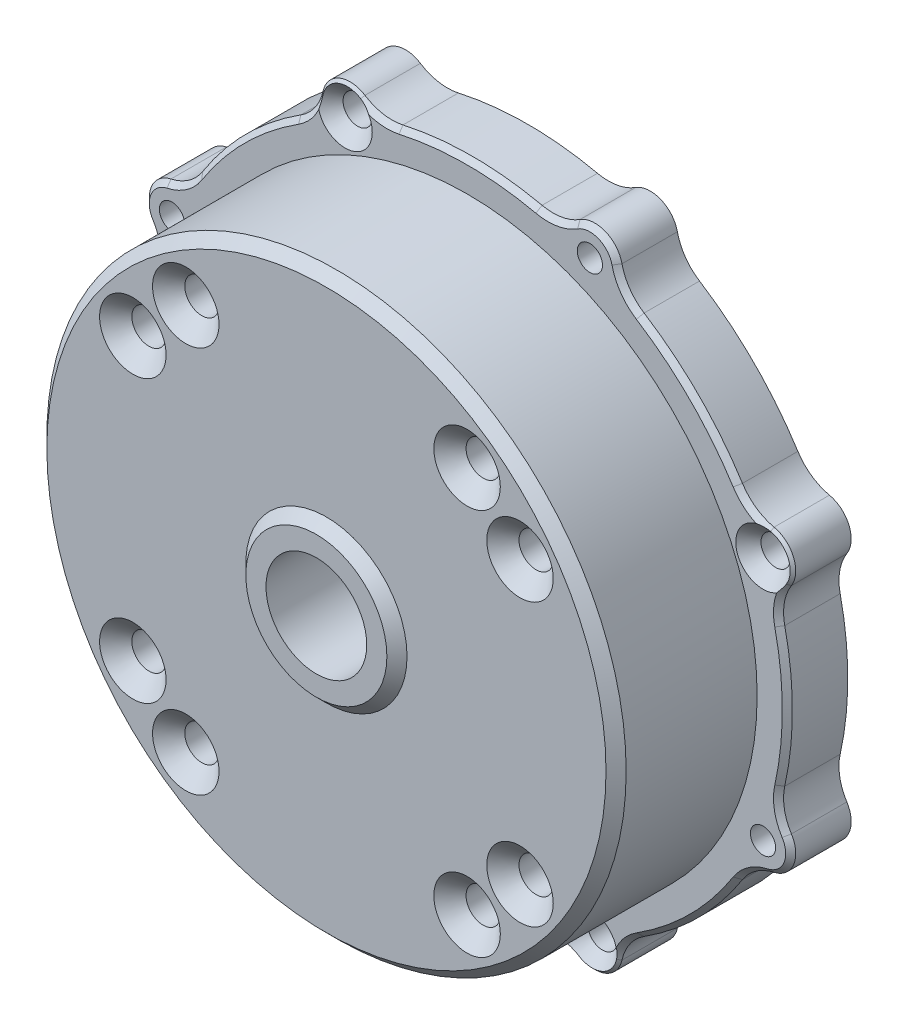
from build123d import *

# Parameters (mm, degrees)
SKETCH_1_R                = 28.75
SKETCH_1_R_2              = 5
SKETCH_1_R_3              = 1.5
EXTRUDE_1_DEPTH           = 3
EXTRUDE_START             = 17
SKETCH_2_R                = 28.75
SKETCH_2_R_2              = 27
EXTRUDE_2_DEPTH           = 17
SKETCH_3_R                = 27
SKETCH_3_R_2              = 1.25
EXTRUDE_3_DEPTH           = 6
CHAMFER_1_SIZE            = 1
CHAMFER_2_SIZE            = 0.5
HOLE_WIZARD_0_D           = 3.4
HOLE_WIZARD_0_DEPTH       = 6.35
HOLE_WIZARD_0_CSINK_D     = 6.6
HOLE_WIZARD_0_CSINK_ANGLE = 90
HOLE_WIZARD_0_TIP         = 1.021463052
EXTRUDE_START_2           = 5
SKETCH_7_R                = 27
SKETCH_7_R_2              = 5
SKETCH_7_R_3              = 1.7
EXTRUDE_4_DEPTH           = 5
SKETCH_8_R                = 7
SKETCH_8_R_2              = 5
EXTRUDE_5_DEPTH           = 1
CHAMFER_3_SIZE            = 1
CUT_EXTRUDE_1_DEPTH       = 11
CUT_EXTRUDE_1_DEPTH_BACK  = 9.5
FILLET_1_R                = 0.5
HOLE_START                = -18
HOLE_WIZARD_1_OUTLINE_R   = 1.45
HOLE_WIZARD_1_OUTLINE_R_2 = 1.25
HOLE_WIZARD_1_DEPTH       = 7


with BuildPart() as part:
    # 草图1 → 凸台-拉伸1 (new body)
    with BuildSketch(Plane.XY):
        Circle(SKETCH_1_R)
        Circle(SKETCH_1_R_2, mode=Mode.SUBTRACT)
        with Locations((13.959899742, 19.214153616)):
            Circle(SKETCH_1_R_3, mode=Mode.SUBTRACT)
        with Locations((19.214153616, 13.959899742)):
            Circle(SKETCH_1_R_3, mode=Mode.SUBTRACT)
        with Locations((19.214153616, -13.959899742)):
            Circle(SKETCH_1_R_3, mode=Mode.SUBTRACT)
        with Locations((13.959899742, -19.214153616)):
            Circle(SKETCH_1_R_3, mode=Mode.SUBTRACT)
        with Locations((-13.959899742, -19.214153616)):
            Circle(SKETCH_1_R_3, mode=Mode.SUBTRACT)
        with Locations((-19.214153616, -13.959899742)):
            Circle(SKETCH_1_R_3, mode=Mode.SUBTRACT)
        with Locations((-19.214153616, 13.959899742)):
            Circle(SKETCH_1_R_3, mode=Mode.SUBTRACT)
        with Locations((-13.959899742, 19.214153616)):
            Circle(SKETCH_1_R_3, mode=Mode.SUBTRACT)
    extrude(amount=EXTRUDE_1_DEPTH)

    # 草图2 → 凸台-拉伸2 (add)
    with BuildSketch(Plane(origin=(0, 0, 0), x_dir=(-1, 0, 0), z_dir=(0, 0, -1)).offset(EXTRUDE_START)):
        with Locations(Location((0, 0, 0), (0, 0, 90))):
            Circle(SKETCH_2_R)
        with Locations(Location((0, 0, 0), (0, 0, 90))):
            Circle(SKETCH_2_R_2, mode=Mode.SUBTRACT)
    extrude(amount=-EXTRUDE_2_DEPTH)

    # 草图3 → 凸台-拉伸3 (add)
    with BuildSketch(Plane(origin=(0, 0, -17), x_dir=(-1, 0, 0), z_dir=(0, 0, -1))):
        with BuildLine():
            ThreePointArc((-30.990743265, 6.901907846), (-30.946539181, 8.853668896), (-31.653110683, 10.673581506))
            ThreePointArc((-31.653110683, 10.673581506), (-31.873843872, 13.202578417), (-29.929491072, 14.834767347))
            ThreePointArc((-29.929491072, 14.834767347), (-28.142997024, 15.622018395), (-26.794150557, 17.033378876))
            ThreePointArc((-26.794150557, 17.033378876), (-22.450640303, 22.450640303), (-17.033378876, 26.794150557))
            ThreePointArc((-17.033378876, 26.794150557), (-15.622018395, 28.142997024), (-14.834767347, 29.929491072))
            ThreePointArc((-14.834767347, 29.929491072), (-13.202578417, 31.873843872), (-10.673581506, 31.653110683))
            ThreePointArc((-10.673581506, 31.653110683), (-8.853668896, 30.946539181), (-6.901907846, 30.990743265))
            ThreePointArc((-6.901907846, 30.990743265), (0, 31.75), (6.901907846, 30.990743265))
            ThreePointArc((6.901907846, 30.990743265), (8.853668896, 30.946539181), (10.673581506, 31.653110683))
            ThreePointArc((10.673581506, 31.653110683), (13.202578417, 31.873843872), (14.834767347, 29.929491072))
            ThreePointArc((14.834767347, 29.929491072), (15.622018395, 28.142997024), (17.033378876, 26.794150557))
            ThreePointArc((17.033378876, 26.794150557), (22.450640303, 22.450640303), (26.794150557, 17.033378876))
            ThreePointArc((26.794150557, 17.033378876), (28.142997024, 15.622018395), (29.929491072, 14.834767347))
            ThreePointArc((29.929491072, 14.834767347), (31.873843872, 13.202578417), (31.653110683, 10.673581506))
            ThreePointArc((31.653110683, 10.673581506), (30.946539181, 8.853668896), (30.990743265, 6.901907846))
            ThreePointArc((30.990743265, 6.901907846), (31.75, 0), (30.990743265, -6.901907846))
            ThreePointArc((30.990743265, -6.901907846), (30.946539181, -8.853668896), (31.653110683, -10.673581506))
            ThreePointArc((31.653110683, -10.673581506), (31.873843872, -13.202578417), (29.929491072, -14.834767347))
            ThreePointArc((29.929491072, -14.834767347), (28.142997024, -15.622018395), (26.794150557, -17.033378876))
            ThreePointArc((26.794150557, -17.033378876), (22.450640303, -22.450640303), (17.033378876, -26.794150557))
            ThreePointArc((17.033378876, -26.794150557), (15.622018395, -28.142997024), (14.834767347, -29.929491072))
            ThreePointArc((14.834767347, -29.929491072), (13.202578417, -31.873843872), (10.673581506, -31.653110683))
            ThreePointArc((10.673581506, -31.653110683), (8.853668896, -30.946539181), (6.901907846, -30.990743265))
            ThreePointArc((6.901907846, -30.990743265), (0, -31.75), (-6.901907846, -30.990743265))
            ThreePointArc((-6.901907846, -30.990743265), (-8.853668896, -30.946539181), (-10.673581506, -31.653110683))
            ThreePointArc((-10.673581506, -31.653110683), (-13.202578417, -31.873843872), (-14.834767347, -29.929491072))
            ThreePointArc((-14.834767347, -29.929491072), (-15.622018395, -28.142997024), (-17.033378876, -26.794150557))
            ThreePointArc((-17.033378876, -26.794150557), (-22.450640303, -22.450640303), (-26.794150557, -17.033378876))
            ThreePointArc((-26.794150557, -17.033378876), (-28.142997024, -15.622018395), (-29.929491072, -14.834767347))
            ThreePointArc((-29.929491072, -14.834767347), (-31.873843872, -13.202578417), (-31.653110683, -10.673581506))
            ThreePointArc((-31.653110683, -10.673581506), (-30.946539181, -8.853668896), (-30.990743265, -6.901907846))
            ThreePointArc((-30.990743265, -6.901907846), (-31.75, 0), (-30.990743265, 6.901907846))
        make_face()
        with Locations(Location((0, 0, 0), (0, 0, 90))):
            Circle(SKETCH_3_R, mode=Mode.SUBTRACT)
        with Locations(Location((-29.333175157, 12.150198978, 0), (0, 0, 90))):
            Circle(SKETCH_3_R_2, mode=Mode.SUBTRACT)
        with Locations(Location((-12.150198978, 29.333175157, 0), (0, 0, 90))):
            Circle(SKETCH_3_R_2, mode=Mode.SUBTRACT)
        with Locations(Location((12.150198978, 29.333175157, 0), (0, 0, 90))):
            Circle(SKETCH_3_R_2, mode=Mode.SUBTRACT)
        with Locations(Location((29.333175157, 12.150198978, 0), (0, 0, 90))):
            Circle(SKETCH_3_R_2, mode=Mode.SUBTRACT)
        with Locations(Location((29.333175157, -12.150198978, 0), (0, 0, 90))):
            Circle(SKETCH_3_R_2, mode=Mode.SUBTRACT)
        with Locations(Location((12.150198978, -29.333175157, 0), (0, 0, 90))):
            Circle(SKETCH_3_R_2, mode=Mode.SUBTRACT)
        with Locations(Location((-12.150198978, -29.333175157, 0), (0, 0, 90))):
            Circle(SKETCH_3_R_2, mode=Mode.SUBTRACT)
        with Locations(Location((-29.333175157, -12.150198978, 0), (0, 0, 90))):
            Circle(SKETCH_3_R_2, mode=Mode.SUBTRACT)
    extrude(amount=-EXTRUDE_3_DEPTH)

    # 倒角1
    chamfer_1_edges = [part.edges().sort_by_distance(p)[0] for p in [
        (-28.75, 0, 3),
    ]]
    chamfer(chamfer_1_edges, length=CHAMFER_1_SIZE)

    # 倒角2
    chamfer_2_edges = [part.edges().sort_by_distance(p)[0] for p in [
        (31.75, 0, -11),
        (30.946539181, 8.853668896, -11),
        (31.873843872, 13.202578417, -11),
        (28.142997024, 15.622018395, -11),
        (22.450640303, 22.450640303, -11),
        (15.622018395, 28.142997024, -11),
        (13.202578417, 31.873843872, -11),
        (8.853668896, 30.946539181, -11),
        (0, 31.75, -11),
        (-8.853668896, 30.946539181, -11),
        (-13.202578417, 31.873843872, -11),
        (-15.622018395, 28.142997024, -11),
        (-22.450640303, 22.450640303, -11),
        (-28.142997024, 15.622018395, -11),
        (-31.873843872, 13.202578417, -11),
        (-30.946539181, 8.853668896, -11),
        (-31.75, 0, -11),
        (-30.946539181, -8.853668896, -11),
        (-31.873843872, -13.202578417, -11),
        (-28.142997024, -15.622018395, -11),
        (-22.450640303, -22.450640303, -11),
        (-15.622018395, -28.142997024, -11),
        (-13.202578417, -31.873843872, -11),
        (-8.853668896, -30.946539181, -11),
        (0, -31.75, -11),
        (8.853668896, -30.946539181, -11),
        (13.202578417, -31.873843872, -11),
        (15.622018395, -28.142997024, -11),
        (22.450640303, -22.450640303, -11),
        (28.142997024, -15.622018395, -11),
        (31.873843872, -13.202578417, -11),
        (30.946539181, -8.853668896, -11),
    ]]
    chamfer(chamfer_2_edges, length=CHAMFER_2_SIZE)

    # 打孔尺寸(%根据十字)槽沉头木螺钉的类型0
    with Locations(Plane.XY.offset(3)):
        with Locations((19.214153616, 13.959899742), (13.959899742, 19.214153616), (-13.959899742, 19.214153616), (-19.214153616, 13.959899742), (-19.214153616, -13.959899742), (-13.959899742, -19.214153616), (13.959899742, -19.214153616), (19.214153616, -13.959899742)):
            CounterSinkHole(HOLE_WIZARD_0_D / 2, HOLE_WIZARD_0_CSINK_D / 2, depth=HOLE_WIZARD_0_DEPTH, counter_sink_angle=HOLE_WIZARD_0_CSINK_ANGLE)
            with Locations((0, 0, -(HOLE_WIZARD_0_DEPTH + HOLE_WIZARD_0_TIP / 2))):  # 118° drill point
                Cone(0, HOLE_WIZARD_0_D / 2, HOLE_WIZARD_0_TIP, mode=Mode.SUBTRACT)

    # 草图7 → 凸台-拉伸4 (add)
    with BuildSketch(Plane(origin=(0, 0, 0), x_dir=(-1, 0, 0), z_dir=(0, 0, -1)).offset(EXTRUDE_START_2)):
        with Locations(Location((0, 0, 0), (0, 0, 90))):
            Circle(SKETCH_7_R)
        Circle(SKETCH_7_R_2, mode=Mode.SUBTRACT)
        with Locations(Location((19.214153616, -13.959899742, 0), (0, 0, 180))):
            Circle(SKETCH_7_R_3, mode=Mode.SUBTRACT)
        with Locations(Location((13.959899742, -19.214153616, 0), (0, 0, 180))):
            Circle(SKETCH_7_R_3, mode=Mode.SUBTRACT)
        with Locations(Location((-13.959899742, -19.214153616, 0), (0, 0, 180))):
            Circle(SKETCH_7_R_3, mode=Mode.SUBTRACT)
        with Locations(Location((-19.214153616, -13.959899742, 0), (0, 0, 180))):
            Circle(SKETCH_7_R_3, mode=Mode.SUBTRACT)
        with Locations(Location((-19.214153616, 13.959899742, 0), (0, 0, 180))):
            Circle(SKETCH_7_R_3, mode=Mode.SUBTRACT)
        with Locations(Location((-13.959899742, 19.214153616, 0), (0, 0, 180))):
            Circle(SKETCH_7_R_3, mode=Mode.SUBTRACT)
        with Locations(Location((19.214153616, 13.959899742, 0), (0, 0, 180))):
            Circle(SKETCH_7_R_3, mode=Mode.SUBTRACT)
        with Locations(Location((13.959899742, 19.214153616, 0), (0, 0, 180))):
            Circle(SKETCH_7_R_3, mode=Mode.SUBTRACT)
    extrude(amount=-EXTRUDE_4_DEPTH)

    # 草图8 → 凸台-拉伸5 (add)
    with BuildSketch(Plane.XY.offset(3)):
        Circle(SKETCH_8_R)
        with Locations(Location((0, 0, 0), (0, 0, 180))):
            Circle(SKETCH_8_R_2, mode=Mode.SUBTRACT)
    extrude(amount=EXTRUDE_5_DEPTH)

    # 倒角3
    chamfer_3_edges = [part.edges().sort_by_distance(p)[0] for p in [
        (-7, 0, 3),
    ]]
    chamfer(chamfer_3_edges, length=CHAMFER_3_SIZE - 0.0001)  # a hair under: the kernel refuses the full size

    # 草图9 → 切除-拉伸1 (cut, two sides: drawn at the far end of the back side and taken through both)
    with BuildSketch(Plane.ZY.offset(29.5).offset(-CUT_EXTRUDE_1_DEPTH_BACK)):
        with BuildLine():
            Line((-9.9, 7.85), (-17, 7.85))
            Line((-17, 7.85), (-17, -7.85))
            Line((-17, -7.85), (-9.9, -7.85))
            ThreePointArc((-9.9, -7.85), (-9.546446609, -7.703553391), (-9.4, -7.35))
            Line((-9.4, -7.35), (-9.4, 7.35))
            ThreePointArc((-9.4, 7.35), (-9.546446609, 7.703553391), (-9.9, 7.85))
        make_face()
    extrude(amount=CUT_EXTRUDE_1_DEPTH + CUT_EXTRUDE_1_DEPTH_BACK, mode=Mode.SUBTRACT)

    # 圆角1
    fillet_1_edges = [part.edges().sort_by_distance(p)[0] for p in [
        (-30.873102814, -7.85, -14.25),
        (-30.873102814, 7.85, -14.25),
    ]]
    fillet(fillet_1_edges, radius=FILLET_1_R)

    # 打孔尺寸(%根据十字)槽沉头木螺钉的类型1: read off the stored shape, not the designer's step
    # 打孔尺寸(%根据十字)槽沉头木螺钉的类型1 outline → 打孔尺寸(%根据十字)槽沉头木螺钉的类型1 (cut)
    # profile 1 of 4: a face of its own
    with BuildSketch(Plane.XY.offset(HOLE_START)):
        with Locations((-12.150198978, 29.333175157)):
            Circle(HOLE_WIZARD_1_OUTLINE_R)
        with Locations((-12.150198978, 29.333175157)):
            Circle(HOLE_WIZARD_1_OUTLINE_R_2, mode=Mode.SUBTRACT)
    # profile 2 of 4: a face of its own
    with BuildSketch(Plane.XY.offset(HOLE_START)):
        with Locations((29.333175157, 12.150198978)):
            Circle(HOLE_WIZARD_1_OUTLINE_R)
        with Locations((29.333175157, 12.150198978)):
            Circle(HOLE_WIZARD_1_OUTLINE_R_2, mode=Mode.SUBTRACT)
    # profile 3 of 4: a face of its own
    with BuildSketch(Plane.XY.offset(HOLE_START)):
        with Locations((12.150198978, -29.333175157)):
            Circle(HOLE_WIZARD_1_OUTLINE_R)
        with Locations((12.150198978, -29.333175157)):
            Circle(HOLE_WIZARD_1_OUTLINE_R_2, mode=Mode.SUBTRACT)
    # profile 4 of 4: a face of its own
    with BuildSketch(Plane.XY.offset(HOLE_START)):
        with Locations((-29.333175157, -12.150198978)):
            Circle(HOLE_WIZARD_1_OUTLINE_R)
        with Locations((-29.333175157, -12.150198978)):
            Circle(HOLE_WIZARD_1_OUTLINE_R_2, mode=Mode.SUBTRACT)
    extrude(amount=HOLE_WIZARD_1_DEPTH, mode=Mode.SUBTRACT)

    # Hole Wizard 1 2: loft between two sections, ruled curve by curve
    hole_wizard_1_2_from = [
        Edge.make_three_point_arc((-10.700198978, 29.333175157, -12.25), (-12.150198978, 30.783175157, -12.25), (-13.600198978, 29.333175157, -12.25)),
        Edge.make_three_point_arc((-13.600198978, 29.333175157, -12.25), (-12.150198978, 27.883175157, -12.25), (-10.700198978, 29.333175157, -12.25)),
    ]
    hole_wizard_1_2_to = [
        Edge.make_three_point_arc((-9.450198976, 29.333175157, -10.999999999), (-12.150198978, 32.033175158, -10.999999999), (-14.850198979, 29.333175157, -10.999999999)),
        Edge.make_three_point_arc((-14.850198979, 29.333175157, -10.999999999), (-12.150198978, 26.633175156, -10.999999999), (-9.450198976, 29.333175157, -10.999999999)),
    ]
    hole_wizard_1_2 = Solid(Shell([*[Face.make_surface_from_curves(hole_wizard_1_2_from[k], hole_wizard_1_2_to[k]) for k in range(2)], Face(Wire(hole_wizard_1_2_from)), Face(Wire(hole_wizard_1_2_to))]))
    add(hole_wizard_1_2, mode=Mode.SUBTRACT)

    # Hole Wizard 1 3: loft between two sections, ruled curve by curve
    hole_wizard_1_3_from = [
        Edge.make_three_point_arc((30.783175157, 12.150198978, -12.25), (29.333175157, 13.600198978, -12.25), (27.883175157, 12.150198978, -12.25)),
        Edge.make_three_point_arc((27.883175157, 12.150198978, -12.25), (29.333175157, 10.700198978, -12.25), (30.783175157, 12.150198978, -12.25)),
    ]
    hole_wizard_1_3_to = [
        Edge.make_three_point_arc((32.033175158, 12.150198978, -10.999999999), (29.333175157, 14.850198979, -10.999999999), (26.633175156, 12.150198978, -10.999999999)),
        Edge.make_three_point_arc((26.633175156, 12.150198978, -10.999999999), (29.333175157, 9.450198976, -10.999999999), (32.033175158, 12.150198978, -10.999999999)),
    ]
    hole_wizard_1_3 = Solid(Shell([*[Face.make_surface_from_curves(hole_wizard_1_3_from[k], hole_wizard_1_3_to[k]) for k in range(2)], Face(Wire(hole_wizard_1_3_from)), Face(Wire(hole_wizard_1_3_to))]))
    add(hole_wizard_1_3, mode=Mode.SUBTRACT)

    # Hole Wizard 1 4: loft between two sections, ruled curve by curve
    hole_wizard_1_4_from = [
        Edge.make_three_point_arc((13.600198978, -29.333175157, -12.25), (12.150198978, -27.883175157, -12.25), (10.700198978, -29.333175157, -12.25)),
        Edge.make_three_point_arc((10.700198978, -29.333175157, -12.25), (12.150198978, -30.783175157, -12.25), (13.600198978, -29.333175157, -12.25)),
    ]
    hole_wizard_1_4_to = [
        Edge.make_three_point_arc((14.850198979, -29.333175157, -10.999999999), (12.150198978, -26.633175156, -10.999999999), (9.450198976, -29.333175157, -10.999999999)),
        Edge.make_three_point_arc((9.450198976, -29.333175157, -10.999999999), (12.150198978, -32.033175158, -10.999999999), (14.850198979, -29.333175157, -10.999999999)),
    ]
    hole_wizard_1_4 = Solid(Shell([*[Face.make_surface_from_curves(hole_wizard_1_4_from[k], hole_wizard_1_4_to[k]) for k in range(2)], Face(Wire(hole_wizard_1_4_from)), Face(Wire(hole_wizard_1_4_to))]))
    add(hole_wizard_1_4, mode=Mode.SUBTRACT)

    # Hole Wizard 1 5: loft between two sections, ruled curve by curve
    hole_wizard_1_5_from = [
        Edge.make_three_point_arc((-27.883175157, -12.150198978, -12.25), (-29.333175157, -10.700198978, -12.25), (-30.783175157, -12.150198978, -12.25)),
        Edge.make_three_point_arc((-30.783175157, -12.150198978, -12.25), (-29.333175157, -13.600198978, -12.25), (-27.883175157, -12.150198978, -12.25)),
    ]
    hole_wizard_1_5_to = [
        Edge.make_three_point_arc((-26.633175156, -12.150198978, -10.999999999), (-29.333175157, -9.450198976, -10.999999999), (-32.033175158, -12.150198978, -10.999999999)),
        Edge.make_three_point_arc((-32.033175158, -12.150198978, -10.999999999), (-29.333175157, -14.850198979, -10.999999999), (-26.633175156, -12.150198978, -10.999999999)),
    ]
    hole_wizard_1_5 = Solid(Shell([*[Face.make_surface_from_curves(hole_wizard_1_5_from[k], hole_wizard_1_5_to[k]) for k in range(2)], Face(Wire(hole_wizard_1_5_from)), Face(Wire(hole_wizard_1_5_to))]))
    add(hole_wizard_1_5, mode=Mode.SUBTRACT)


solid = part.part
